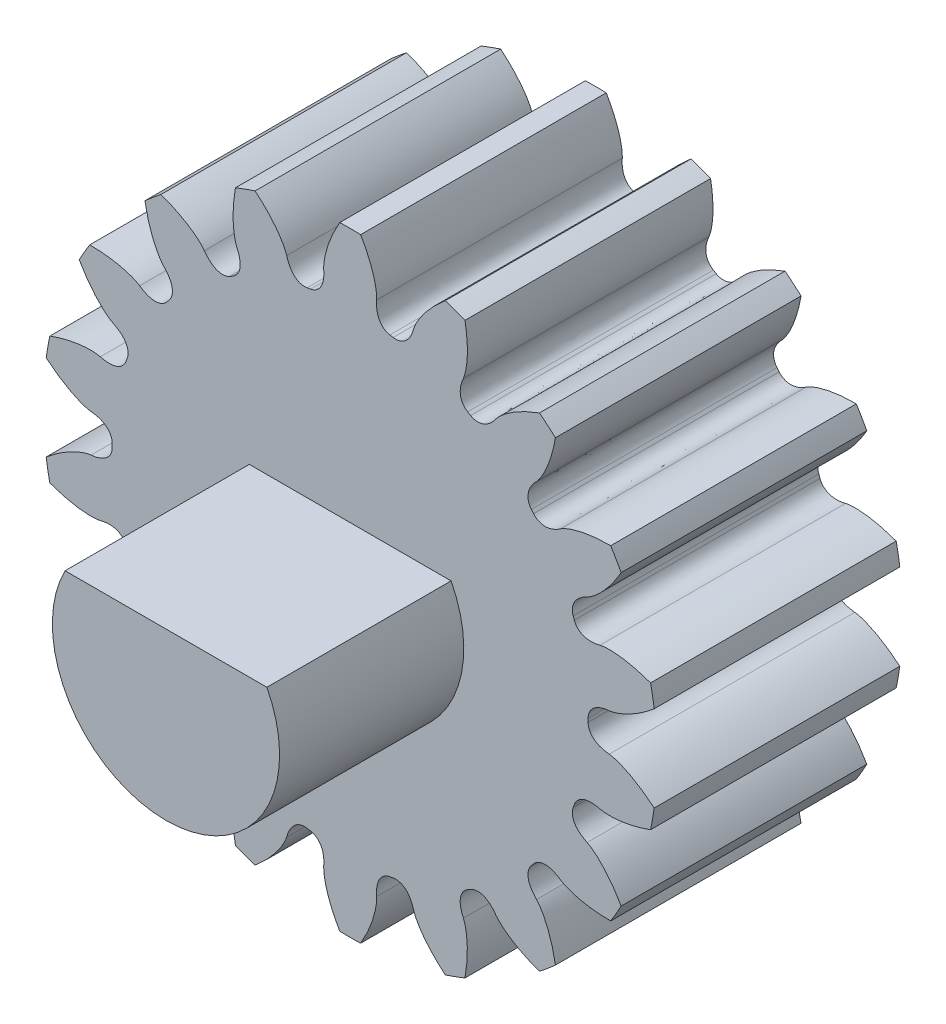
from build123d import *

# Parameters (mm, degrees)
SKETCH1_R           = 5.5
EXTRUDE1_DEPTH      = 4
EXTRUDE2_DEPTH      = 3
EXTRUDE3_DEPTH      = 3.5
EXTRUDE5_DEPTH      = 11.464224768
EXTRUDE5_DEPTH_BACK = 11.464224768
SKETCH4_R           = 6.338783536


with BuildPart() as part:
    # Sketch1 → Extrude1 (new body)
    with BuildSketch(Plane.XY):
        Circle(SKETCH1_R)
    extrude(amount=EXTRUDE1_DEPTH)

    # Sketch2 → Extrude2 (add)
    with BuildSketch(Plane.XY.offset(4)):
        with BuildLine():
            ThreePointArc((-1.643167673, 0.85), (0, -1.85), (1.643167673, 0.85))
            Line((1.643167673, 0.85), (-1.643167673, 0.85))
        make_face()
    extrude(amount=EXTRUDE2_DEPTH)

    # Sketch3 → Extrude3 (cut)
    with BuildSketch(Plane(origin=(0, 0, 0), x_dir=(-1, 0, 0), z_dir=(0, 0, -1))):
        with BuildLine():
            ThreePointArc((-1.183215957, 1.15), (0, -1.65), (1.183215957, 1.15))
            Line((1.183215957, 1.15), (-1.183215957, 1.15))
        make_face()
    extrude(amount=-EXTRUDE3_DEPTH, mode=Mode.SUBTRACT)

    # Sketch4 → Extrude5 (cut, two sides: drawn at the far end of the back side and taken through both)
    with BuildSketch(Plane.XY.offset(-EXTRUDE5_DEPTH_BACK)):
        Circle(SKETCH4_R)
        with BuildLine():
            ThreePointArc((-0.645581629, 3.820844064), (-0.672886688, 3.816130043), (-0.700157341, 3.811220893))
            add(Edge.make_bspline(
                [(-1.033630549, 4.101069767), (-1.023055352, 4.057563785), (-1.007391639, 4.016629667), (-0.986639413, 3.978267412), (-0.974742217, 3.956274435), (-0.961550555, 3.934381948), (-0.945930501, 3.914824361), (-0.934621825, 3.900664971), (-0.922273971, 3.88695488), (-0.908780274, 3.874846556), (-0.897658569, 3.864866696), (-0.885714305, 3.85548826), (-0.873152403, 3.847388455), (-0.861998879, 3.840196761), (-0.850198651, 3.833694375), (-0.838069558, 3.828303491), (-0.826810099, 3.823299124), (-0.815055067, 3.819044124), (-0.803167091, 3.815800059), (-0.791816041, 3.812702513), (-0.780107092, 3.810398525), (-0.768419709, 3.809033981), (-0.757043467, 3.807705765), (-0.745440399, 3.807203948), (-0.733992753, 3.807581383), (-0.722686966, 3.807954141), (-0.711408495, 3.809167311), (-0.700157341, 3.811220893)],
                knots=[0, 0, 0, 0, 1, 1, 1, 2, 2, 2, 3, 3, 3, 4, 4, 4, 5, 5, 5, 6, 6, 6, 7, 7, 7, 8, 8, 8, 9, 9, 9, 9], degree=3))
            add(Edge.make_bspline(
                [(-1.033630549, 4.101069767), (-1.042964335, 4.128461375), (-1.053737549, 4.155176869), (-1.065950192, 4.181216248), (-1.078417533, 4.207798686), (-1.092953075, 4.233520587), (-1.107852498, 4.258849733), (-1.123046455, 4.284679588), (-1.139430845, 4.309879699), (-1.156341967, 4.334627531), (-1.17357983, 4.359853517), (-1.191731228, 4.384510939), (-1.210387, 4.408711326), (-1.229396009, 4.433369934), (-1.249168041, 4.457488062), (-1.269409797, 4.481147841), (-1.290027516, 4.505247067), (-1.311310066, 4.528820391), (-1.333029253, 4.551933707), (-1.355144386, 4.575468383), (-1.377853424, 4.598484746), (-1.400969349, 4.621038616), (-1.424499074, 4.643996224), (-1.448567936, 4.666438989), (-1.473017052, 4.688416004), (-1.497896092, 4.710779472), (-1.523223717, 4.732643722), (-1.548999928, 4.754008753)],
                knots=[0, 0, 0, 0, 1, 1, 1, 2, 2, 2, 3, 3, 3, 4, 4, 4, 5, 5, 5, 6, 6, 6, 7, 7, 7, 8, 8, 8, 9, 9, 9, 9], degree=3))
            ThreePointArc((-1.548999928, 4.754008753), (-1.710100717, 4.698463104), (-1.869215136, 4.637459949))
            add(Edge.make_bspline(
                [(-1.844309894, 3.806006616), (-1.854766786, 3.832989447), (-1.863686414, 3.860379591), (-1.871068777, 3.888177048), (-1.878605101, 3.91655423), (-1.884003949, 3.945601615), (-1.888871589, 3.974582031), (-1.893835454, 4.004135335), (-1.897482602, 4.033971423), (-1.900435531, 4.063799622), (-1.903445513, 4.094204133), (-1.905390221, 4.124760307), (-1.90665478, 4.155290579), (-1.907943282, 4.186398925), (-1.908299861, 4.2175837), (-1.908001988, 4.248719291), (-1.907698584, 4.280433184), (-1.906547845, 4.312171557), (-1.904766935, 4.343838209), (-1.902953558, 4.37608215), (-1.90035206, 4.408310795), (-1.897141581, 4.440446693), (-1.893873632, 4.473157856), (-1.889861745, 4.505821177), (-1.885259189, 4.538372137), (-1.880575699, 4.571495486), (-1.875227681, 4.604524757), (-1.869215136, 4.637459949)],
                knots=[0, 0, 0, 0, 1, 1, 1, 2, 2, 2, 3, 3, 3, 4, 4, 4, 5, 5, 5, 6, 6, 6, 7, 7, 7, 8, 8, 8, 9, 9, 9, 9], degree=3))
            add(Edge.make_bspline(
                [(-1.844309894, 3.806006616), (-1.824445859, 3.765881494), (-1.810133015, 3.7244557), (-1.801371361, 3.681729234), (-1.796348328, 3.657234266), (-1.792381509, 3.631984211), (-1.791775789, 3.606961854), (-1.791337258, 3.588846055), (-1.791983586, 3.570406468), (-1.794537277, 3.552457372), (-1.796642067, 3.537663462), (-1.799763561, 3.522801538), (-1.804180083, 3.508522093), (-1.808101446, 3.495843588), (-1.812961291, 3.483277431), (-1.818787523, 3.471351344), (-1.824196023, 3.460280336), (-1.830465839, 3.449464828), (-1.837487312, 3.439338286), (-1.844191657, 3.429669113), (-1.851680257, 3.420377789), (-1.8597562, 3.411819983), (-1.867617146, 3.403490003), (-1.87618305, 3.39564728), (-1.885195066, 3.388578007), (-1.894095406, 3.381596337), (-1.903515026, 3.375276018), (-1.913453928, 3.369617051)],
                knots=[0, 0, 0, 0, 1, 1, 1, 2, 2, 2, 3, 3, 3, 4, 4, 4, 5, 5, 5, 6, 6, 6, 7, 7, 7, 8, 8, 8, 9, 9, 9, 9], degree=3))
            ThreePointArc((-1.913453928, 3.369617051), (-1.9375, 3.35584844), (-1.961447003, 3.341908235))
            add(Edge.make_bspline(
                [(-2.373943469, 3.500222529), (-2.349126112, 3.462957209), (-2.320406744, 3.429849025), (-2.287785366, 3.400897977), (-2.269083617, 3.384300419), (-2.249199838, 3.368240026), (-2.227832701, 3.355204278), (-2.212363225, 3.345766599), (-2.19607091, 3.337106542), (-2.179249692, 3.330343556), (-2.165385394, 3.324769402), (-2.150953843, 3.320041734), (-2.136379221, 3.316726831), (-2.123438632, 3.313783578), (-2.110126099, 3.31170925), (-2.096884688, 3.31079187), (-2.084592663, 3.309940266), (-2.072091251, 3.309962331), (-2.059810672, 3.310979834), (-2.048084751, 3.311951381), (-2.036293927, 3.313791036), (-2.024844678, 3.316506106), (-2.013700231, 3.319148895), (-2.002625282, 3.322645824), (-1.991997104, 3.326915822), (-1.98150063, 3.331132907), (-1.971317263, 3.336130378), (-1.961447003, 3.341908235)],
                knots=[0, 0, 0, 0, 1, 1, 1, 2, 2, 2, 3, 3, 3, 4, 4, 4, 5, 5, 5, 6, 6, 6, 7, 7, 7, 8, 8, 8, 9, 9, 9, 9], degree=3))
            add(Edge.make_bspline(
                [(-2.373943469, 3.500222529), (-2.39208284, 3.522769878), (-2.411343587, 3.544189574), (-2.43172571, 3.564481617), (-2.452532908, 3.585196856), (-2.474989257, 3.604396088), (-2.497653214, 3.623101797), (-2.520765194, 3.642177282), (-2.544780429, 3.660253848), (-2.569135943, 3.677725259), (-2.593962031, 3.695534236), (-2.6194521, 3.712496489), (-2.645259812, 3.728856765), (-2.671556178, 3.745526813), (-2.698384696, 3.761428007), (-2.725497846, 3.776737838), (-2.753114585, 3.792332028), (-2.781176191, 3.807204646), (-2.809490771, 3.821495658), (-2.838321532, 3.836047199), (-2.867533107, 3.849908557), (-2.89696885, 3.863196151), (-2.926931522, 3.876721605), (-2.957224732, 3.88957887), (-2.987715968, 3.901868418), (-3.018743375, 3.914374072), (-3.050021571, 3.926257188), (-3.081550557, 3.937517767)],
                knots=[0, 0, 0, 0, 1, 1, 1, 2, 2, 2, 3, 3, 3, 4, 4, 4, 5, 5, 5, 6, 6, 6, 7, 7, 7, 8, 8, 8, 9, 9, 9, 9], degree=3))
            ThreePointArc((-3.081550557, 3.937517767), (-3.213938048, 3.830222216), (-3.342592386, 3.718477664))
            add(Edge.make_bspline(
                [(-3.034815326, 2.945685197), (-3.053870262, 2.967464297), (-3.071619951, 2.990151921), (-3.088064394, 3.013748069), (-3.10485179, 3.037836323), (-3.119859838, 3.063285421), (-3.13434581, 3.088853274), (-3.149118143, 3.114926554), (-3.162749884, 3.141715907), (-3.175726574, 3.168735285), (-3.188953987, 3.196276704), (-3.201232242, 3.224324987), (-3.212862506, 3.252581553), (-3.224712983, 3.281373143), (-3.235713879, 3.310555288), (-3.24608297, 3.339915052), (-3.256644653, 3.369820134), (-3.266418475, 3.400038025), (-3.2755756, 3.430404051), (-3.284899661, 3.461323655), (-3.293477897, 3.492498441), (-3.301452159, 3.523794355), (-3.309569168, 3.555650497), (-3.316970741, 3.587716126), (-3.323778837, 3.619878189), (-3.330706648, 3.652605804), (-3.336977831, 3.685472296), (-3.342592386, 3.718477664)],
                knots=[0, 0, 0, 0, 1, 1, 1, 2, 2, 2, 3, 3, 3, 4, 4, 4, 5, 5, 5, 6, 6, 6, 7, 7, 7, 8, 8, 8, 9, 9, 9, 9], degree=3))
            add(Edge.make_bspline(
                [(-3.034815326, 2.945685197), (-3.002425639, 2.914773816), (-2.974807509, 2.880741585), (-2.951960936, 2.843588502), (-2.938863056, 2.822288739), (-2.926499438, 2.799918181), (-2.917372097, 2.776612025), (-2.910764044, 2.759738729), (-2.905064684, 2.742190128), (-2.901325417, 2.724450082), (-2.898243457, 2.709828473), (-2.896093624, 2.694795218), (-2.895359939, 2.67986639), (-2.894708511, 2.666611307), (-2.894977393, 2.653140818), (-2.896373298, 2.639941273), (-2.897669118, 2.627688112), (-2.899861696, 2.615380456), (-2.902996241, 2.603463134), (-2.905989213, 2.592084063), (-2.909848375, 2.580791821), (-2.914510337, 2.569987979), (-2.919048189, 2.559471757), (-2.924415137, 2.549172296), (-2.930465828, 2.539447062), (-2.93644154, 2.529842342), (-2.943131411, 2.520681485), (-2.950535442, 2.511964491)],
                knots=[0, 0, 0, 0, 1, 1, 1, 2, 2, 2, 3, 3, 3, 4, 4, 4, 5, 5, 5, 6, 6, 6, 7, 7, 7, 8, 8, 8, 9, 9, 9, 9], degree=3))
            ThreePointArc((-2.950535442, 2.511964491), (-2.968422217, 2.490801988), (-2.986157208, 2.469512123))
            add(Edge.make_bspline(
                [(-3.427923771, 2.477196796), (-3.391857593, 2.450666886), (-3.35354655, 2.429377972), (-3.31299064, 2.413330055), (-3.289740046, 2.404129826), (-3.265562427, 2.395838646), (-3.241025398, 2.390897042), (-3.223260969, 2.387319397), (-3.204989287, 2.384753905), (-3.186869435, 2.384151972), (-3.171934784, 2.38365585), (-3.156756604, 2.384149176), (-3.141927175, 2.386019001), (-3.128760348, 2.38767919), (-3.115541196, 2.390283114), (-3.102784578, 2.393949888), (-3.090942587, 2.397353761), (-3.079202649, 2.401650231), (-3.068010686, 2.406806576), (-3.057324213, 2.411730033), (-3.046873662, 2.417491443), (-3.037043496, 2.423958647), (-3.027475028, 2.430253682), (-3.018264, 2.437327576), (-3.009737206, 2.444975113), (-3.001316074, 2.452527882), (-2.993456075, 2.460706885), (-2.986157208, 2.469512123)],
                knots=[0, 0, 0, 0, 1, 1, 1, 2, 2, 2, 3, 3, 3, 4, 4, 4, 5, 5, 5, 6, 6, 6, 7, 7, 7, 8, 8, 8, 9, 9, 9, 9], degree=3))
            add(Edge.make_bspline(
                [(-3.427923771, 2.477196796), (-3.452680852, 2.492180344), (-3.478106001, 2.505720711), (-3.504199219, 2.517817897), (-3.530836618, 2.530167373), (-3.558505208, 2.540528226), (-3.58620009, 2.550354312), (-3.614442447, 2.560374642), (-3.643191937, 2.569147364), (-3.672054208, 2.577235044), (-3.701474128, 2.585478986), (-3.73122839, 2.592700173), (-3.76107525, 2.599247046), (-3.791487244, 2.60591788), (-3.822136333, 2.611684221), (-3.85285063, 2.616797513), (-3.884135403, 2.622005777), (-3.915591423, 2.626383832), (-3.947086239, 2.630128834), (-3.979155211, 2.633942109), (-4.011345977, 2.636976578), (-4.043551152, 2.639395214), (-4.076332832, 2.641857146), (-4.109196581, 2.643578135), (-4.142052244, 2.644697917), (-4.175485654, 2.645837388), (-4.20894181, 2.646306092), (-4.24242071, 2.646104027)],
                knots=[0, 0, 0, 0, 1, 1, 1, 2, 2, 2, 3, 3, 3, 4, 4, 4, 5, 5, 5, 6, 6, 6, 7, 7, 7, 8, 8, 8, 9, 9, 9, 9], degree=3))
            ThreePointArc((-4.24242071, 2.646104027), (-4.330127019, 2.5), (-4.412803663, 2.350992095))
            add(Edge.make_bspline(
                [(-3.859277241, 1.73007067), (-3.884631914, 1.744019157), (-3.909070791, 1.759267799), (-3.93259387, 1.775816595), (-3.95660753, 1.792710521), (-3.979414586, 1.811491797), (-4.001771668, 1.830563225), (-4.024570707, 1.850011658), (-4.046542852, 1.870523086), (-4.067978123, 1.891474706), (-4.089827546, 1.912831133), (-4.11095841, 1.934988487), (-4.131551598, 1.957563189), (-4.152534707, 1.980565332), (-4.172853049, 2.00422505), (-4.192638438, 2.028267766), (-4.212791314, 2.052757042), (-4.23231083, 2.077809727), (-4.251301505, 2.103212537), (-4.270638384, 2.129078444), (-4.289361694, 2.15543923), (-4.307558882, 2.182120412), (-4.326081818, 2.209279213), (-4.344004113, 2.236879561), (-4.361401703, 2.264773509), (-4.37910522, 2.293157956), (-4.396239207, 2.321897484), (-4.412803663, 2.350992095)],
                knots=[0, 0, 0, 0, 1, 1, 1, 2, 2, 2, 3, 3, 3, 4, 4, 4, 5, 5, 5, 6, 6, 6, 7, 7, 7, 8, 8, 8, 9, 9, 9, 9], degree=3))
            add(Edge.make_bspline(
                [(-3.859277241, 1.73007067), (-3.818268576, 1.712101399), (-3.780676314, 1.689567519), (-3.746500455, 1.662469029), (-3.726907527, 1.646933538), (-3.707638344, 1.630140697), (-3.691090275, 1.611361808), (-3.679109729, 1.597766184), (-3.667752107, 1.583225188), (-3.658170892, 1.567833903), (-3.650273912, 1.555148177), (-3.643112055, 1.541756825), (-3.637316656, 1.52797925), (-3.632171009, 1.515746348), (-3.627816497, 1.502996265), (-3.624613707, 1.490115323), (-3.621640553, 1.478157921), (-3.619491436, 1.465842602), (-3.61836098, 1.453571905), (-3.617281582, 1.441855419), (-3.617045834, 1.429924272), (-3.617731514, 1.418177497), (-3.61839894, 1.406743443), (-3.619919599, 1.395229511), (-3.622279162, 1.384021322), (-3.624609487, 1.372952024), (-3.627762712, 1.362055564), (-3.631738838, 1.351331941)],
                knots=[0, 0, 0, 0, 1, 1, 1, 2, 2, 2, 3, 3, 3, 4, 4, 4, 5, 5, 5, 6, 6, 6, 7, 7, 7, 8, 8, 8, 9, 9, 9, 9], degree=3))
            ThreePointArc((-3.631738838, 1.351331941), (-3.641308906, 1.325328055), (-3.650692784, 1.299256403))
            add(Edge.make_bspline(
                [(-4.068445875, 1.15538457), (-4.025480991, 1.142789968), (-3.982199149, 1.135888082), (-3.938600348, 1.13467891), (-3.913605273, 1.133985695), (-3.888049993, 1.134463767), (-3.863302599, 1.138212336), (-3.845385869, 1.140926242), (-3.827338655, 1.144764752), (-3.81010569, 1.150396474), (-3.795902025, 1.155038224), (-3.781807929, 1.160693041), (-3.768512342, 1.167522065), (-3.75670739, 1.173585453), (-3.745176045, 1.180553557), (-3.734442856, 1.188362218), (-3.724479217, 1.195611012), (-3.714916763, 1.203663668), (-3.706163332, 1.212336925), (-3.697805254, 1.22061845), (-3.689955467, 1.229606703), (-3.682930046, 1.239046002), (-3.676091656, 1.248234008), (-3.669855536, 1.258031652), (-3.664458581, 1.268134322), (-3.659128505, 1.278111799), (-3.654539906, 1.288485826), (-3.650692784, 1.299256403)],
                knots=[0, 0, 0, 0, 1, 1, 1, 2, 2, 2, 3, 3, 3, 4, 4, 4, 5, 5, 5, 6, 6, 6, 7, 7, 7, 8, 8, 8, 9, 9, 9, 9], degree=3))
            add(Edge.make_bspline(
                [(-4.068445875, 1.15538457), (-4.096834597, 1.160997079), (-4.1253575, 1.165024948), (-4.154014586, 1.167468179), (-4.183269323, 1.169962364), (-4.212812913, 1.170235165), (-4.242198309, 1.169996459), (-4.272164598, 1.169753034), (-4.302180729, 1.168163792), (-4.332068541, 1.165892246), (-4.362533817, 1.163576812), (-4.39296347, 1.160185952), (-4.423249506, 1.156129773), (-4.454108992, 1.151996792), (-4.48488192, 1.146932774), (-4.515492767, 1.141232789), (-4.546672168, 1.135426933), (-4.577728541, 1.128782367), (-4.608604853, 1.121529656), (-4.640044047, 1.114144727), (-4.671331321, 1.105986306), (-4.702421508, 1.097244262), (-4.734068242, 1.088345726), (-4.765538677, 1.078722863), (-4.796795889, 1.068537814), (-4.82860274, 1.058173668), (-4.860201549, 1.047171426), (-4.891592314, 1.035531089)],
                knots=[0, 0, 0, 0, 1, 1, 1, 2, 2, 2, 3, 3, 3, 4, 4, 4, 5, 5, 5, 6, 6, 6, 7, 7, 7, 8, 8, 8, 9, 9, 9, 9], degree=3))
            ThreePointArc((-4.891592314, 1.035531089), (-4.924038765, 0.868240888), (-4.950765693, 0.699942181))
            add(Edge.make_bspline(
                [(-4.218253363, 0.305784087), (-4.246849626, 0.310219568), (-4.275030001, 0.316190016), (-4.302794487, 0.323695431), (-4.331138009, 0.331357374), (-4.358993206, 0.341205527), (-4.386524803, 0.351480235), (-4.414600648, 0.361958054), (-4.442263032, 0.373717574), (-4.469571474, 0.386074363), (-4.497407544, 0.398669897), (-4.524842321, 0.412263818), (-4.551914591, 0.426433814), (-4.57949946, 0.440872112), (-4.606684557, 0.456155692), (-4.633499834, 0.471981453), (-4.660813168, 0.488101156), (-4.687724036, 0.504966911), (-4.714257706, 0.522342551), (-4.74127509, 0.540034951), (-4.767885166, 0.558402238), (-4.794110431, 0.577250542), (-4.820805154, 0.596436251), (-4.847086477, 0.616242308), (-4.872975156, 0.636503718), (-4.899319073, 0.657121414), (-4.925249252, 0.678267569), (-4.950765693, 0.699942181)],
                knots=[0, 0, 0, 0, 1, 1, 1, 2, 2, 2, 3, 3, 3, 4, 4, 4, 5, 5, 5, 6, 6, 6, 7, 7, 7, 8, 8, 8, 9, 9, 9, 9], degree=3))
            add(Edge.make_bspline(
                [(-4.218253363, 0.305784087), (-4.173571971, 0.302924285), (-4.130539759, 0.294606675), (-4.089156727, 0.280831257), (-4.065431946, 0.272933846), (-4.041581347, 0.263744186), (-4.01960849, 0.251757575), (-4.003700482, 0.243079456), (-3.988054496, 0.233299925), (-3.973786969, 0.222113816), (-3.962027461, 0.212894059), (-3.950717405, 0.202759804), (-3.940559303, 0.191795262), (-3.931540078, 0.18206001), (-3.92308739, 0.171568182), (-3.91567221, 0.160559473), (-3.908788686, 0.15034007), (-3.90255709, 0.139502497), (-3.897297983, 0.128358452), (-3.892276407, 0.117717733), (-3.887974184, 0.106586752), (-3.884600879, 0.095313877), (-3.881317377, 0.084341108), (-3.878808332, 0.073001456), (-3.87719217, 0.061662185), (-3.875596036, 0.05046343), (-3.874832289, 0.03914564), (-3.874900931, 0.027708815)],
                knots=[0, 0, 0, 0, 1, 1, 1, 2, 2, 2, 3, 3, 3, 4, 4, 4, 5, 5, 5, 6, 6, 6, 7, 7, 7, 8, 8, 8, 9, 9, 9, 9], degree=3))
            ThreePointArc((-3.874900931, 0.027708815), (-3.875, 0), (-3.874900931, -0.027708815))
            add(Edge.make_bspline(
                [(-4.218253363, -0.305784087), (-4.173571971, -0.302924285), (-4.130539759, -0.294606675), (-4.089156727, -0.280831257), (-4.065431946, -0.272933846), (-4.041581347, -0.263744186), (-4.01960849, -0.251757575), (-4.003700482, -0.243079456), (-3.988054496, -0.233299925), (-3.973786969, -0.222113816), (-3.962027461, -0.212894059), (-3.950717405, -0.202759804), (-3.940559303, -0.191795262), (-3.931540078, -0.18206001), (-3.92308739, -0.171568182), (-3.91567221, -0.160559473), (-3.908788686, -0.15034007), (-3.90255709, -0.139502497), (-3.897297983, -0.128358452), (-3.892276407, -0.117717733), (-3.887974184, -0.106586752), (-3.884600879, -0.095313877), (-3.881317377, -0.084341108), (-3.878808332, -0.073001456), (-3.87719217, -0.061662185), (-3.875596036, -0.05046343), (-3.874832289, -0.03914564), (-3.874900931, -0.027708815)],
                knots=[0, 0, 0, 0, 1, 1, 1, 2, 2, 2, 3, 3, 3, 4, 4, 4, 5, 5, 5, 6, 6, 6, 7, 7, 7, 8, 8, 8, 9, 9, 9, 9], degree=3))
            add(Edge.make_bspline(
                [(-4.218253363, -0.305784087), (-4.246849626, -0.310219568), (-4.275030001, -0.316190016), (-4.302794487, -0.323695431), (-4.331138009, -0.331357374), (-4.358993206, -0.341205527), (-4.386524803, -0.351480235), (-4.414600648, -0.361958054), (-4.442263032, -0.373717574), (-4.469571474, -0.386074363), (-4.497407544, -0.398669897), (-4.524842321, -0.412263818), (-4.551914591, -0.426433814), (-4.57949946, -0.440872112), (-4.606684557, -0.456155692), (-4.633499834, -0.471981453), (-4.660813168, -0.488101156), (-4.687724036, -0.504966911), (-4.714257706, -0.522342551), (-4.74127509, -0.540034951), (-4.767885166, -0.558402238), (-4.794110431, -0.577250542), (-4.820805154, -0.596436251), (-4.847086477, -0.616242308), (-4.872975156, -0.636503718), (-4.899319073, -0.657121414), (-4.925249252, -0.678267569), (-4.950765693, -0.699942181)],
                knots=[0, 0, 0, 0, 1, 1, 1, 2, 2, 2, 3, 3, 3, 4, 4, 4, 5, 5, 5, 6, 6, 6, 7, 7, 7, 8, 8, 8, 9, 9, 9, 9], degree=3))
            ThreePointArc((-4.950765693, -0.699942181), (-4.924038765, -0.868240888), (-4.891592314, -1.035531089))
            add(Edge.make_bspline(
                [(-4.068445875, -1.15538457), (-4.096834597, -1.160997079), (-4.1253575, -1.165024948), (-4.154014586, -1.167468179), (-4.183269323, -1.169962364), (-4.212812913, -1.170235165), (-4.242198309, -1.169996459), (-4.272164598, -1.169753034), (-4.302180729, -1.168163792), (-4.332068541, -1.165892246), (-4.362533817, -1.163576812), (-4.39296347, -1.160185952), (-4.423249506, -1.156129773), (-4.454108992, -1.151996792), (-4.48488192, -1.146932774), (-4.515492767, -1.141232789), (-4.546672168, -1.135426933), (-4.577728541, -1.128782367), (-4.608604853, -1.121529656), (-4.640044047, -1.114144727), (-4.671331321, -1.105986306), (-4.702421508, -1.097244262), (-4.734068242, -1.088345726), (-4.765538677, -1.078722863), (-4.796795889, -1.068537814), (-4.82860274, -1.058173668), (-4.860201549, -1.047171426), (-4.891592314, -1.035531089)],
                knots=[0, 0, 0, 0, 1, 1, 1, 2, 2, 2, 3, 3, 3, 4, 4, 4, 5, 5, 5, 6, 6, 6, 7, 7, 7, 8, 8, 8, 9, 9, 9, 9], degree=3))
            add(Edge.make_bspline(
                [(-4.068445875, -1.15538457), (-4.025480991, -1.142789968), (-3.982199149, -1.135888082), (-3.938600348, -1.13467891), (-3.913605273, -1.133985695), (-3.888049993, -1.134463767), (-3.863302599, -1.138212336), (-3.845385869, -1.140926242), (-3.827338655, -1.144764752), (-3.81010569, -1.150396474), (-3.795902025, -1.155038224), (-3.781807929, -1.160693041), (-3.768512342, -1.167522065), (-3.75670739, -1.173585453), (-3.745176045, -1.180553557), (-3.734442856, -1.188362218), (-3.724479217, -1.195611012), (-3.714916763, -1.203663668), (-3.706163332, -1.212336925), (-3.697805254, -1.22061845), (-3.689955467, -1.229606703), (-3.682930046, -1.239046002), (-3.676091656, -1.248234008), (-3.669855536, -1.258031652), (-3.664458581, -1.268134322), (-3.659128505, -1.278111799), (-3.654539906, -1.288485826), (-3.650692784, -1.299256403)],
                knots=[0, 0, 0, 0, 1, 1, 1, 2, 2, 2, 3, 3, 3, 4, 4, 4, 5, 5, 5, 6, 6, 6, 7, 7, 7, 8, 8, 8, 9, 9, 9, 9], degree=3))
            ThreePointArc((-3.650692784, -1.299256403), (-3.641308906, -1.325328055), (-3.631738838, -1.351331941))
            add(Edge.make_bspline(
                [(-3.859277241, -1.73007067), (-3.818268576, -1.712101399), (-3.780676314, -1.689567519), (-3.746500455, -1.662469029), (-3.726907527, -1.646933538), (-3.707638344, -1.630140697), (-3.691090275, -1.611361808), (-3.679109729, -1.597766184), (-3.667752107, -1.583225188), (-3.658170892, -1.567833903), (-3.650273912, -1.555148177), (-3.643112055, -1.541756825), (-3.637316656, -1.52797925), (-3.632171009, -1.515746348), (-3.627816497, -1.502996265), (-3.624613707, -1.490115323), (-3.621640553, -1.478157921), (-3.619491436, -1.465842602), (-3.61836098, -1.453571905), (-3.617281582, -1.441855419), (-3.617045834, -1.429924272), (-3.617731514, -1.418177497), (-3.61839894, -1.406743443), (-3.619919599, -1.395229511), (-3.622279162, -1.384021322), (-3.624609487, -1.372952024), (-3.627762712, -1.362055564), (-3.631738838, -1.351331941)],
                knots=[0, 0, 0, 0, 1, 1, 1, 2, 2, 2, 3, 3, 3, 4, 4, 4, 5, 5, 5, 6, 6, 6, 7, 7, 7, 8, 8, 8, 9, 9, 9, 9], degree=3))
            add(Edge.make_bspline(
                [(-3.859277241, -1.73007067), (-3.884631914, -1.744019157), (-3.909070791, -1.759267799), (-3.93259387, -1.775816595), (-3.95660753, -1.792710521), (-3.979414586, -1.811491797), (-4.001771668, -1.830563225), (-4.024570707, -1.850011658), (-4.046542852, -1.870523086), (-4.067978123, -1.891474706), (-4.089827546, -1.912831133), (-4.11095841, -1.934988487), (-4.131551598, -1.957563189), (-4.152534707, -1.980565332), (-4.172853049, -2.00422505), (-4.192638438, -2.028267766), (-4.212791314, -2.052757042), (-4.23231083, -2.077809727), (-4.251301505, -2.103212537), (-4.270638384, -2.129078444), (-4.289361694, -2.15543923), (-4.307558882, -2.182120412), (-4.326081818, -2.209279213), (-4.344004113, -2.236879561), (-4.361401703, -2.264773509), (-4.37910522, -2.293157956), (-4.396239207, -2.321897484), (-4.412803663, -2.350992095)],
                knots=[0, 0, 0, 0, 1, 1, 1, 2, 2, 2, 3, 3, 3, 4, 4, 4, 5, 5, 5, 6, 6, 6, 7, 7, 7, 8, 8, 8, 9, 9, 9, 9], degree=3))
            ThreePointArc((-4.412803663, -2.350992095), (-4.330127019, -2.5), (-4.24242071, -2.646104027))
            add(Edge.make_bspline(
                [(-3.427923771, -2.477196796), (-3.452680852, -2.492180344), (-3.478106001, -2.505720711), (-3.504199219, -2.517817897), (-3.530836618, -2.530167373), (-3.558505208, -2.540528226), (-3.58620009, -2.550354312), (-3.614442447, -2.560374642), (-3.643191937, -2.569147364), (-3.672054208, -2.577235044), (-3.701474128, -2.585478986), (-3.73122839, -2.592700173), (-3.76107525, -2.599247046), (-3.791487244, -2.60591788), (-3.822136333, -2.611684221), (-3.85285063, -2.616797513), (-3.884135403, -2.622005777), (-3.915591423, -2.626383832), (-3.947086239, -2.630128834), (-3.979155211, -2.633942109), (-4.011345977, -2.636976578), (-4.043551152, -2.639395214), (-4.076332832, -2.641857146), (-4.109196581, -2.643578135), (-4.142052244, -2.644697917), (-4.175485654, -2.645837388), (-4.20894181, -2.646306092), (-4.24242071, -2.646104027)],
                knots=[0, 0, 0, 0, 1, 1, 1, 2, 2, 2, 3, 3, 3, 4, 4, 4, 5, 5, 5, 6, 6, 6, 7, 7, 7, 8, 8, 8, 9, 9, 9, 9], degree=3))
            add(Edge.make_bspline(
                [(-3.427923771, -2.477196796), (-3.391857593, -2.450666886), (-3.35354655, -2.429377972), (-3.31299064, -2.413330055), (-3.289740046, -2.404129826), (-3.265562427, -2.395838646), (-3.241025398, -2.390897042), (-3.223260969, -2.387319397), (-3.204989287, -2.384753905), (-3.186869435, -2.384151972), (-3.171934784, -2.38365585), (-3.156756604, -2.384149176), (-3.141927175, -2.386019001), (-3.128760348, -2.38767919), (-3.115541196, -2.390283114), (-3.102784578, -2.393949888), (-3.090942587, -2.397353761), (-3.079202649, -2.401650231), (-3.068010686, -2.406806576), (-3.057324213, -2.411730033), (-3.046873662, -2.417491443), (-3.037043496, -2.423958647), (-3.027475028, -2.430253682), (-3.018264, -2.437327576), (-3.009737206, -2.444975113), (-3.001316074, -2.452527882), (-2.993456075, -2.460706885), (-2.986157208, -2.469512123)],
                knots=[0, 0, 0, 0, 1, 1, 1, 2, 2, 2, 3, 3, 3, 4, 4, 4, 5, 5, 5, 6, 6, 6, 7, 7, 7, 8, 8, 8, 9, 9, 9, 9], degree=3))
            ThreePointArc((-2.986157208, -2.469512123), (-2.968422217, -2.490801988), (-2.950535442, -2.511964491))
            add(Edge.make_bspline(
                [(-3.034815326, -2.945685197), (-3.002425639, -2.914773816), (-2.974807509, -2.880741585), (-2.951960936, -2.843588502), (-2.938863056, -2.822288739), (-2.926499438, -2.799918181), (-2.917372097, -2.776612025), (-2.910764044, -2.759738729), (-2.905064684, -2.742190128), (-2.901325417, -2.724450082), (-2.898243457, -2.709828473), (-2.896093624, -2.694795218), (-2.895359939, -2.67986639), (-2.894708511, -2.666611307), (-2.894977393, -2.653140818), (-2.896373298, -2.639941273), (-2.897669118, -2.627688112), (-2.899861696, -2.615380456), (-2.902996241, -2.603463134), (-2.905989213, -2.592084063), (-2.909848375, -2.580791821), (-2.914510337, -2.569987979), (-2.919048189, -2.559471757), (-2.924415137, -2.549172296), (-2.930465828, -2.539447062), (-2.93644154, -2.529842342), (-2.943131411, -2.520681485), (-2.950535442, -2.511964491)],
                knots=[0, 0, 0, 0, 1, 1, 1, 2, 2, 2, 3, 3, 3, 4, 4, 4, 5, 5, 5, 6, 6, 6, 7, 7, 7, 8, 8, 8, 9, 9, 9, 9], degree=3))
            add(Edge.make_bspline(
                [(-3.034815326, -2.945685197), (-3.053870262, -2.967464297), (-3.071619951, -2.990151921), (-3.088064394, -3.013748069), (-3.10485179, -3.037836323), (-3.119859838, -3.063285421), (-3.13434581, -3.088853274), (-3.149118143, -3.114926554), (-3.162749884, -3.141715907), (-3.175726574, -3.168735285), (-3.188953987, -3.196276704), (-3.201232242, -3.224324987), (-3.212862506, -3.252581553), (-3.224712983, -3.281373143), (-3.235713879, -3.310555288), (-3.24608297, -3.339915052), (-3.256644653, -3.369820134), (-3.266418475, -3.400038025), (-3.2755756, -3.430404051), (-3.284899661, -3.461323655), (-3.293477897, -3.492498441), (-3.301452159, -3.523794355), (-3.309569168, -3.555650497), (-3.316970741, -3.587716126), (-3.323778837, -3.619878189), (-3.330706648, -3.652605804), (-3.336977831, -3.685472296), (-3.342592386, -3.718477664)],
                knots=[0, 0, 0, 0, 1, 1, 1, 2, 2, 2, 3, 3, 3, 4, 4, 4, 5, 5, 5, 6, 6, 6, 7, 7, 7, 8, 8, 8, 9, 9, 9, 9], degree=3))
            ThreePointArc((-3.342592386, -3.718477664), (-3.213938048, -3.830222216), (-3.081550557, -3.937517767))
            add(Edge.make_bspline(
                [(-2.373943469, -3.500222529), (-2.39208284, -3.522769878), (-2.411343587, -3.544189574), (-2.43172571, -3.564481617), (-2.452532908, -3.585196856), (-2.474989257, -3.604396088), (-2.497653214, -3.623101797), (-2.520765194, -3.642177282), (-2.544780429, -3.660253848), (-2.569135943, -3.677725259), (-2.593962031, -3.695534236), (-2.6194521, -3.712496489), (-2.645259812, -3.728856765), (-2.671556178, -3.745526813), (-2.698384696, -3.761428007), (-2.725497846, -3.776737838), (-2.753114585, -3.792332028), (-2.781176191, -3.807204646), (-2.809490771, -3.821495658), (-2.838321532, -3.836047199), (-2.867533107, -3.849908557), (-2.89696885, -3.863196151), (-2.926931522, -3.876721605), (-2.957224732, -3.88957887), (-2.987715968, -3.901868418), (-3.018743375, -3.914374072), (-3.050021571, -3.926257188), (-3.081550557, -3.937517767)],
                knots=[0, 0, 0, 0, 1, 1, 1, 2, 2, 2, 3, 3, 3, 4, 4, 4, 5, 5, 5, 6, 6, 6, 7, 7, 7, 8, 8, 8, 9, 9, 9, 9], degree=3))
            add(Edge.make_bspline(
                [(-2.373943469, -3.500222529), (-2.349126112, -3.462957209), (-2.320406744, -3.429849025), (-2.287785366, -3.400897977), (-2.269083617, -3.384300419), (-2.249199838, -3.368240026), (-2.227832701, -3.355204278), (-2.212363225, -3.345766599), (-2.19607091, -3.337106542), (-2.179249692, -3.330343556), (-2.165385394, -3.324769402), (-2.150953843, -3.320041734), (-2.136379221, -3.316726831), (-2.123438632, -3.313783578), (-2.110126099, -3.31170925), (-2.096884688, -3.31079187), (-2.084592663, -3.309940266), (-2.072091251, -3.309962331), (-2.059810672, -3.310979834), (-2.048084751, -3.311951381), (-2.036293927, -3.313791036), (-2.024844678, -3.316506106), (-2.013700231, -3.319148895), (-2.002625282, -3.322645824), (-1.991997104, -3.326915822), (-1.98150063, -3.331132907), (-1.971317263, -3.336130378), (-1.961447003, -3.341908235)],
                knots=[0, 0, 0, 0, 1, 1, 1, 2, 2, 2, 3, 3, 3, 4, 4, 4, 5, 5, 5, 6, 6, 6, 7, 7, 7, 8, 8, 8, 9, 9, 9, 9], degree=3))
            ThreePointArc((-1.961447003, -3.341908235), (-1.9375, -3.35584844), (-1.913453928, -3.369617051))
            add(Edge.make_bspline(
                [(-1.844309894, -3.806006616), (-1.824445859, -3.765881494), (-1.810133015, -3.7244557), (-1.801371361, -3.681729234), (-1.796348328, -3.657234266), (-1.792381509, -3.631984211), (-1.791775789, -3.606961854), (-1.791337258, -3.588846055), (-1.791983586, -3.570406468), (-1.794537277, -3.552457372), (-1.796642067, -3.537663462), (-1.799763561, -3.522801538), (-1.804180083, -3.508522093), (-1.808101446, -3.495843588), (-1.812961291, -3.483277431), (-1.818787523, -3.471351344), (-1.824196023, -3.460280336), (-1.830465839, -3.449464828), (-1.837487312, -3.439338286), (-1.844191657, -3.429669113), (-1.851680257, -3.420377789), (-1.8597562, -3.411819983), (-1.867617146, -3.403490003), (-1.87618305, -3.39564728), (-1.885195066, -3.388578007), (-1.894095406, -3.381596337), (-1.903515026, -3.375276018), (-1.913453928, -3.369617051)],
                knots=[0, 0, 0, 0, 1, 1, 1, 2, 2, 2, 3, 3, 3, 4, 4, 4, 5, 5, 5, 6, 6, 6, 7, 7, 7, 8, 8, 8, 9, 9, 9, 9], degree=3))
            add(Edge.make_bspline(
                [(-1.844309894, -3.806006616), (-1.854766786, -3.832989447), (-1.863686414, -3.860379591), (-1.871068777, -3.888177048), (-1.878605101, -3.91655423), (-1.884003949, -3.945601615), (-1.888871589, -3.974582031), (-1.893835454, -4.004135335), (-1.897482602, -4.033971423), (-1.900435531, -4.063799622), (-1.903445513, -4.094204133), (-1.905390221, -4.124760307), (-1.90665478, -4.155290579), (-1.907943282, -4.186398925), (-1.908299861, -4.2175837), (-1.908001988, -4.248719291), (-1.907698584, -4.280433184), (-1.906547845, -4.312171557), (-1.904766935, -4.343838209), (-1.902953558, -4.37608215), (-1.90035206, -4.408310795), (-1.897141581, -4.440446693), (-1.893873632, -4.473157856), (-1.889861745, -4.505821177), (-1.885259189, -4.538372137), (-1.880575699, -4.571495486), (-1.875227681, -4.604524757), (-1.869215136, -4.637459949)],
                knots=[0, 0, 0, 0, 1, 1, 1, 2, 2, 2, 3, 3, 3, 4, 4, 4, 5, 5, 5, 6, 6, 6, 7, 7, 7, 8, 8, 8, 9, 9, 9, 9], degree=3))
            ThreePointArc((-1.869215136, -4.637459949), (-1.710100717, -4.698463104), (-1.548999928, -4.754008753))
            add(Edge.make_bspline(
                [(-1.033630549, -4.101069767), (-1.042964335, -4.128461375), (-1.053737549, -4.155176869), (-1.065950192, -4.181216248), (-1.078417533, -4.207798686), (-1.092953075, -4.233520587), (-1.107852498, -4.258849733), (-1.123046455, -4.284679588), (-1.139430845, -4.309879699), (-1.156341967, -4.334627531), (-1.17357983, -4.359853517), (-1.191731228, -4.384510939), (-1.210387, -4.408711326), (-1.229396009, -4.433369934), (-1.249168041, -4.457488062), (-1.269409797, -4.481147841), (-1.290027516, -4.505247067), (-1.311310066, -4.528820391), (-1.333029253, -4.551933707), (-1.355144386, -4.575468383), (-1.377853424, -4.598484746), (-1.400969349, -4.621038616), (-1.424499074, -4.643996224), (-1.448567936, -4.666438989), (-1.473017052, -4.688416004), (-1.497896092, -4.710779472), (-1.523223717, -4.732643722), (-1.548999928, -4.754008753)],
                knots=[0, 0, 0, 0, 1, 1, 1, 2, 2, 2, 3, 3, 3, 4, 4, 4, 5, 5, 5, 6, 6, 6, 7, 7, 7, 8, 8, 8, 9, 9, 9, 9], degree=3))
            add(Edge.make_bspline(
                [(-1.033630549, -4.101069767), (-1.023055352, -4.057563785), (-1.007391639, -4.016629667), (-0.986639413, -3.978267412), (-0.974742217, -3.956274435), (-0.961550555, -3.934381948), (-0.945930501, -3.914824361), (-0.934621825, -3.900664971), (-0.922273971, -3.88695488), (-0.908780274, -3.874846556), (-0.897658569, -3.864866696), (-0.885714305, -3.85548826), (-0.873152403, -3.847388455), (-0.861998879, -3.840196761), (-0.850198651, -3.833694375), (-0.838069558, -3.828303491), (-0.826810099, -3.823299124), (-0.815055067, -3.819044124), (-0.803167091, -3.815800059), (-0.791816041, -3.812702513), (-0.780107092, -3.810398525), (-0.768419709, -3.809033981), (-0.757043467, -3.807705765), (-0.745440399, -3.807203948), (-0.733992753, -3.807581383), (-0.722686966, -3.807954141), (-0.711408495, -3.809167311), (-0.700157341, -3.811220893)],
                knots=[0, 0, 0, 0, 1, 1, 1, 2, 2, 2, 3, 3, 3, 4, 4, 4, 5, 5, 5, 6, 6, 6, 7, 7, 7, 8, 8, 8, 9, 9, 9, 9], degree=3))
            ThreePointArc((-0.700157341, -3.811220893), (-0.672886688, -3.816130043), (-0.645581629, -3.820844064))
            add(Edge.make_bspline(
                [(-0.43135347, -4.207267466), (-0.426410983, -4.162768285), (-0.427129765, -4.118945491), (-0.433509815, -4.075799084), (-0.437167481, -4.051063365), (-0.442075917, -4.025979343), (-0.450064877, -4.00225885), (-0.45584876, -3.98508558), (-0.46276282, -3.967979094), (-0.471301457, -3.951985875), (-0.478339128, -3.938804027), (-0.486355451, -3.925906001), (-0.495389481, -3.913998251), (-0.503410661, -3.903425539), (-0.512275301, -3.893279379), (-0.52182913, -3.884065211), (-0.530697966, -3.875511683), (-0.540288786, -3.867492833), (-0.550350294, -3.860378481), (-0.559957369, -3.853585452), (-0.570172172, -3.847415715), (-0.580688018, -3.842136144), (-0.590923912, -3.836997125), (-0.601655598, -3.832557088), (-0.612541957, -3.828996435), (-0.623293412, -3.825479906), (-0.634306636, -3.822762449), (-0.645581629, -3.820844064)],
                knots=[0, 0, 0, 0, 1, 1, 1, 2, 2, 2, 3, 3, 3, 4, 4, 4, 5, 5, 5, 6, 6, 6, 7, 7, 7, 8, 8, 8, 9, 9, 9, 9], degree=3))
            add(Edge.make_bspline(
                [(-0.43135347, -4.207267466), (-0.431951062, -4.236199501), (-0.430964789, -4.264988509), (-0.428394651, -4.293634492), (-0.425770912, -4.322877894), (-0.420909378, -4.352020022), (-0.415571578, -4.380917537), (-0.41012826, -4.410386301), (-0.403350915, -4.43967045), (-0.395923916, -4.46870975), (-0.388353419, -4.498310119), (-0.379730019, -4.52768866), (-0.370476347, -4.556810235), (-0.361047462, -4.586483212), (-0.350716716, -4.615909272), (-0.339787808, -4.645065279), (-0.328655911, -4.67476282), (-0.316719407, -4.704193559), (-0.304215266, -4.733341371), (-0.291483172, -4.763020553), (-0.278015717, -4.792415808), (-0.26400773, -4.821515626), (-0.249748986, -4.85113636), (-0.234807532, -4.880457696), (-0.219349459, -4.909471425), (-0.203619566, -4.938995344), (-0.187297397, -4.968203576), (-0.170382954, -4.997096122)],
                knots=[0, 0, 0, 0, 1, 1, 1, 2, 2, 2, 3, 3, 3, 4, 4, 4, 5, 5, 5, 6, 6, 6, 7, 7, 7, 8, 8, 8, 9, 9, 9, 9], degree=3))
            ThreePointArc((-0.170382954, -4.997096122), (0, -5), (0.170382954, -4.997096122))
            add(Edge.make_bspline(
                [(0.43135347, -4.207267466), (0.431951062, -4.236199501), (0.430964789, -4.264988509), (0.428394651, -4.293634492), (0.425770912, -4.322877894), (0.420909378, -4.352020022), (0.415571578, -4.380917537), (0.41012826, -4.410386301), (0.403350915, -4.43967045), (0.395923916, -4.46870975), (0.388353419, -4.498310119), (0.379730019, -4.52768866), (0.370476347, -4.556810235), (0.361047462, -4.586483212), (0.350716716, -4.615909272), (0.339787808, -4.645065279), (0.328655911, -4.67476282), (0.316719407, -4.704193559), (0.304215266, -4.733341371), (0.291483172, -4.763020553), (0.278015717, -4.792415808), (0.26400773, -4.821515626), (0.249748986, -4.85113636), (0.234807532, -4.880457696), (0.219349459, -4.909471425), (0.203619566, -4.938995344), (0.187297397, -4.968203576), (0.170382954, -4.997096122)],
                knots=[0, 0, 0, 0, 1, 1, 1, 2, 2, 2, 3, 3, 3, 4, 4, 4, 5, 5, 5, 6, 6, 6, 7, 7, 7, 8, 8, 8, 9, 9, 9, 9], degree=3))
            add(Edge.make_bspline(
                [(0.43135347, -4.207267466), (0.426410983, -4.162768285), (0.427129765, -4.118945491), (0.433509815, -4.075799084), (0.437167481, -4.051063365), (0.442075917, -4.025979343), (0.450064877, -4.00225885), (0.45584876, -3.98508558), (0.46276282, -3.967979094), (0.471301457, -3.951985875), (0.478339128, -3.938804027), (0.486355451, -3.925906001), (0.495389481, -3.913998251), (0.503410661, -3.903425539), (0.512275301, -3.893279379), (0.52182913, -3.884065211), (0.530697966, -3.875511683), (0.540288786, -3.867492833), (0.550350294, -3.860378481), (0.559957369, -3.853585452), (0.570172172, -3.847415715), (0.580688018, -3.842136144), (0.590923912, -3.836997125), (0.601655598, -3.832557088), (0.612541957, -3.828996435), (0.623293412, -3.825479906), (0.634306636, -3.822762449), (0.645581629, -3.820844064)],
                knots=[0, 0, 0, 0, 1, 1, 1, 2, 2, 2, 3, 3, 3, 4, 4, 4, 5, 5, 5, 6, 6, 6, 7, 7, 7, 8, 8, 8, 9, 9, 9, 9], degree=3))
            ThreePointArc((0.645581629, -3.820844064), (0.672886688, -3.816130043), (0.700157341, -3.811220893))
            add(Edge.make_bspline(
                [(1.033630549, -4.101069767), (1.023055352, -4.057563785), (1.007391639, -4.016629667), (0.986639413, -3.978267412), (0.974742217, -3.956274435), (0.961550555, -3.934381948), (0.945930501, -3.914824361), (0.934621825, -3.900664971), (0.922273971, -3.88695488), (0.908780274, -3.874846556), (0.897658569, -3.864866696), (0.885714305, -3.85548826), (0.873152403, -3.847388455), (0.861998879, -3.840196761), (0.850198651, -3.833694375), (0.838069558, -3.828303491), (0.826810099, -3.823299124), (0.815055067, -3.819044124), (0.803167091, -3.815800059), (0.791816041, -3.812702513), (0.780107092, -3.810398525), (0.768419709, -3.809033981), (0.757043467, -3.807705765), (0.745440399, -3.807203948), (0.733992753, -3.807581383), (0.722686966, -3.807954141), (0.711408495, -3.809167311), (0.700157341, -3.811220893)],
                knots=[0, 0, 0, 0, 1, 1, 1, 2, 2, 2, 3, 3, 3, 4, 4, 4, 5, 5, 5, 6, 6, 6, 7, 7, 7, 8, 8, 8, 9, 9, 9, 9], degree=3))
            add(Edge.make_bspline(
                [(1.033630549, -4.101069767), (1.042964335, -4.128461375), (1.053737549, -4.155176869), (1.065950192, -4.181216248), (1.078417533, -4.207798686), (1.092953075, -4.233520587), (1.107852498, -4.258849733), (1.123046455, -4.284679588), (1.139430845, -4.309879699), (1.156341967, -4.334627531), (1.17357983, -4.359853517), (1.191731228, -4.384510939), (1.210387, -4.408711326), (1.229396009, -4.433369934), (1.249168041, -4.457488062), (1.269409797, -4.481147841), (1.290027516, -4.505247067), (1.311310066, -4.528820391), (1.333029253, -4.551933707), (1.355144386, -4.575468383), (1.377853424, -4.598484746), (1.400969349, -4.621038616), (1.424499074, -4.643996224), (1.448567936, -4.666438989), (1.473017052, -4.688416004), (1.497896092, -4.710779472), (1.523223717, -4.732643722), (1.548999928, -4.754008753)],
                knots=[0, 0, 0, 0, 1, 1, 1, 2, 2, 2, 3, 3, 3, 4, 4, 4, 5, 5, 5, 6, 6, 6, 7, 7, 7, 8, 8, 8, 9, 9, 9, 9], degree=3))
            ThreePointArc((1.548999928, -4.754008753), (1.710100717, -4.698463104), (1.869215136, -4.637459949))
            add(Edge.make_bspline(
                [(1.844309894, -3.806006616), (1.854766786, -3.832989447), (1.863686414, -3.860379591), (1.871068777, -3.888177048), (1.878605101, -3.91655423), (1.884003949, -3.945601615), (1.888871589, -3.974582031), (1.893835454, -4.004135335), (1.897482602, -4.033971423), (1.900435531, -4.063799622), (1.903445513, -4.094204133), (1.905390221, -4.124760307), (1.90665478, -4.155290579), (1.907943282, -4.186398925), (1.908299861, -4.2175837), (1.908001988, -4.248719291), (1.907698584, -4.280433184), (1.906547845, -4.312171557), (1.904766935, -4.343838209), (1.902953558, -4.37608215), (1.90035206, -4.408310795), (1.897141581, -4.440446693), (1.893873632, -4.473157856), (1.889861745, -4.505821177), (1.885259189, -4.538372137), (1.880575699, -4.571495486), (1.875227681, -4.604524757), (1.869215136, -4.637459949)],
                knots=[0, 0, 0, 0, 1, 1, 1, 2, 2, 2, 3, 3, 3, 4, 4, 4, 5, 5, 5, 6, 6, 6, 7, 7, 7, 8, 8, 8, 9, 9, 9, 9], degree=3))
            add(Edge.make_bspline(
                [(1.844309894, -3.806006616), (1.824445859, -3.765881494), (1.810133015, -3.7244557), (1.801371361, -3.681729234), (1.796348328, -3.657234266), (1.792381509, -3.631984211), (1.791775789, -3.606961854), (1.791337258, -3.588846055), (1.791983586, -3.570406468), (1.794537277, -3.552457372), (1.796642067, -3.537663462), (1.799763561, -3.522801538), (1.804180083, -3.508522093), (1.808101446, -3.495843588), (1.812961291, -3.483277431), (1.818787523, -3.471351344), (1.824196023, -3.460280336), (1.830465839, -3.449464828), (1.837487312, -3.439338286), (1.844191657, -3.429669113), (1.851680257, -3.420377789), (1.8597562, -3.411819983), (1.867617146, -3.403490003), (1.87618305, -3.39564728), (1.885195066, -3.388578007), (1.894095406, -3.381596337), (1.903515026, -3.375276018), (1.913453928, -3.369617051)],
                knots=[0, 0, 0, 0, 1, 1, 1, 2, 2, 2, 3, 3, 3, 4, 4, 4, 5, 5, 5, 6, 6, 6, 7, 7, 7, 8, 8, 8, 9, 9, 9, 9], degree=3))
            ThreePointArc((1.913453928, -3.369617051), (1.9375, -3.35584844), (1.961447003, -3.341908235))
            add(Edge.make_bspline(
                [(2.373943469, -3.500222529), (2.349126112, -3.462957209), (2.320406744, -3.429849025), (2.287785366, -3.400897977), (2.269083617, -3.384300419), (2.249199838, -3.368240026), (2.227832701, -3.355204278), (2.212363225, -3.345766599), (2.19607091, -3.337106542), (2.179249692, -3.330343556), (2.165385394, -3.324769402), (2.150953843, -3.320041734), (2.136379221, -3.316726831), (2.123438632, -3.313783578), (2.110126099, -3.31170925), (2.096884688, -3.31079187), (2.084592663, -3.309940266), (2.072091251, -3.309962331), (2.059810672, -3.310979834), (2.048084751, -3.311951381), (2.036293927, -3.313791036), (2.024844678, -3.316506106), (2.013700231, -3.319148895), (2.002625282, -3.322645824), (1.991997104, -3.326915822), (1.98150063, -3.331132907), (1.971317263, -3.336130378), (1.961447003, -3.341908235)],
                knots=[0, 0, 0, 0, 1, 1, 1, 2, 2, 2, 3, 3, 3, 4, 4, 4, 5, 5, 5, 6, 6, 6, 7, 7, 7, 8, 8, 8, 9, 9, 9, 9], degree=3))
            add(Edge.make_bspline(
                [(2.373943469, -3.500222529), (2.39208284, -3.522769878), (2.411343587, -3.544189574), (2.43172571, -3.564481617), (2.452532908, -3.585196856), (2.474989257, -3.604396088), (2.497653214, -3.623101797), (2.520765194, -3.642177282), (2.544780429, -3.660253848), (2.569135943, -3.677725259), (2.593962031, -3.695534236), (2.6194521, -3.712496489), (2.645259812, -3.728856765), (2.671556178, -3.745526813), (2.698384696, -3.761428007), (2.725497846, -3.776737838), (2.753114585, -3.792332028), (2.781176191, -3.807204646), (2.809490771, -3.821495658), (2.838321532, -3.836047199), (2.867533107, -3.849908557), (2.89696885, -3.863196151), (2.926931522, -3.876721605), (2.957224732, -3.88957887), (2.987715968, -3.901868418), (3.018743375, -3.914374072), (3.050021571, -3.926257188), (3.081550557, -3.937517767)],
                knots=[0, 0, 0, 0, 1, 1, 1, 2, 2, 2, 3, 3, 3, 4, 4, 4, 5, 5, 5, 6, 6, 6, 7, 7, 7, 8, 8, 8, 9, 9, 9, 9], degree=3))
            ThreePointArc((3.081550557, -3.937517767), (3.213938048, -3.830222216), (3.342592386, -3.718477664))
            add(Edge.make_bspline(
                [(3.034815326, -2.945685197), (3.053870262, -2.967464297), (3.071619951, -2.990151921), (3.088064394, -3.013748069), (3.10485179, -3.037836323), (3.119859838, -3.063285421), (3.13434581, -3.088853274), (3.149118143, -3.114926554), (3.162749884, -3.141715907), (3.175726574, -3.168735285), (3.188953987, -3.196276704), (3.201232242, -3.224324987), (3.212862506, -3.252581553), (3.224712983, -3.281373143), (3.235713879, -3.310555288), (3.24608297, -3.339915052), (3.256644653, -3.369820134), (3.266418475, -3.400038025), (3.2755756, -3.430404051), (3.284899661, -3.461323655), (3.293477897, -3.492498441), (3.301452159, -3.523794355), (3.309569168, -3.555650497), (3.316970741, -3.587716126), (3.323778837, -3.619878189), (3.330706648, -3.652605804), (3.336977831, -3.685472296), (3.342592386, -3.718477664)],
                knots=[0, 0, 0, 0, 1, 1, 1, 2, 2, 2, 3, 3, 3, 4, 4, 4, 5, 5, 5, 6, 6, 6, 7, 7, 7, 8, 8, 8, 9, 9, 9, 9], degree=3))
            add(Edge.make_bspline(
                [(3.034815326, -2.945685197), (3.002425639, -2.914773816), (2.974807509, -2.880741585), (2.951960936, -2.843588502), (2.938863056, -2.822288739), (2.926499438, -2.799918181), (2.917372097, -2.776612025), (2.910764044, -2.759738729), (2.905064684, -2.742190128), (2.901325417, -2.724450082), (2.898243457, -2.709828473), (2.896093624, -2.694795218), (2.895359939, -2.67986639), (2.894708511, -2.666611307), (2.894977393, -2.653140818), (2.896373298, -2.639941273), (2.897669118, -2.627688112), (2.899861696, -2.615380456), (2.902996241, -2.603463134), (2.905989213, -2.592084063), (2.909848375, -2.580791821), (2.914510337, -2.569987979), (2.919048189, -2.559471757), (2.924415137, -2.549172296), (2.930465828, -2.539447062), (2.93644154, -2.529842342), (2.943131411, -2.520681485), (2.950535442, -2.511964491)],
                knots=[0, 0, 0, 0, 1, 1, 1, 2, 2, 2, 3, 3, 3, 4, 4, 4, 5, 5, 5, 6, 6, 6, 7, 7, 7, 8, 8, 8, 9, 9, 9, 9], degree=3))
            ThreePointArc((2.950535442, -2.511964491), (2.968422217, -2.490801988), (2.986157208, -2.469512123))
            add(Edge.make_bspline(
                [(3.427923771, -2.477196796), (3.391857593, -2.450666886), (3.35354655, -2.429377972), (3.31299064, -2.413330055), (3.289740046, -2.404129826), (3.265562427, -2.395838646), (3.241025398, -2.390897042), (3.223260969, -2.387319397), (3.204989287, -2.384753905), (3.186869435, -2.384151972), (3.171934784, -2.38365585), (3.156756604, -2.384149176), (3.141927175, -2.386019001), (3.128760348, -2.38767919), (3.115541196, -2.390283114), (3.102784578, -2.393949888), (3.090942587, -2.397353761), (3.079202649, -2.401650231), (3.068010686, -2.406806576), (3.057324213, -2.411730033), (3.046873662, -2.417491443), (3.037043496, -2.423958647), (3.027475028, -2.430253682), (3.018264, -2.437327576), (3.009737206, -2.444975113), (3.001316074, -2.452527882), (2.993456075, -2.460706885), (2.986157208, -2.469512123)],
                knots=[0, 0, 0, 0, 1, 1, 1, 2, 2, 2, 3, 3, 3, 4, 4, 4, 5, 5, 5, 6, 6, 6, 7, 7, 7, 8, 8, 8, 9, 9, 9, 9], degree=3))
            add(Edge.make_bspline(
                [(3.427923771, -2.477196796), (3.452680852, -2.492180344), (3.478106001, -2.505720711), (3.504199219, -2.517817897), (3.530836618, -2.530167373), (3.558505208, -2.540528226), (3.58620009, -2.550354312), (3.614442447, -2.560374642), (3.643191937, -2.569147364), (3.672054208, -2.577235044), (3.701474128, -2.585478986), (3.73122839, -2.592700173), (3.76107525, -2.599247046), (3.791487244, -2.60591788), (3.822136333, -2.611684221), (3.85285063, -2.616797513), (3.884135403, -2.622005777), (3.915591423, -2.626383832), (3.947086239, -2.630128834), (3.979155211, -2.633942109), (4.011345977, -2.636976578), (4.043551152, -2.639395214), (4.076332832, -2.641857146), (4.109196581, -2.643578135), (4.142052244, -2.644697917), (4.175485654, -2.645837388), (4.20894181, -2.646306092), (4.24242071, -2.646104027)],
                knots=[0, 0, 0, 0, 1, 1, 1, 2, 2, 2, 3, 3, 3, 4, 4, 4, 5, 5, 5, 6, 6, 6, 7, 7, 7, 8, 8, 8, 9, 9, 9, 9], degree=3))
            ThreePointArc((4.24242071, -2.646104027), (4.330127019, -2.5), (4.412803663, -2.350992095))
            add(Edge.make_bspline(
                [(3.859277241, -1.73007067), (3.884631914, -1.744019157), (3.909070791, -1.759267799), (3.93259387, -1.775816595), (3.95660753, -1.792710521), (3.979414586, -1.811491797), (4.001771668, -1.830563225), (4.024570707, -1.850011658), (4.046542852, -1.870523086), (4.067978123, -1.891474706), (4.089827546, -1.912831133), (4.11095841, -1.934988487), (4.131551598, -1.957563189), (4.152534707, -1.980565332), (4.172853049, -2.00422505), (4.192638438, -2.028267766), (4.212791314, -2.052757042), (4.23231083, -2.077809727), (4.251301505, -2.103212537), (4.270638384, -2.129078444), (4.289361694, -2.15543923), (4.307558882, -2.182120412), (4.326081818, -2.209279213), (4.344004113, -2.236879561), (4.361401703, -2.264773509), (4.37910522, -2.293157956), (4.396239207, -2.321897484), (4.412803663, -2.350992095)],
                knots=[0, 0, 0, 0, 1, 1, 1, 2, 2, 2, 3, 3, 3, 4, 4, 4, 5, 5, 5, 6, 6, 6, 7, 7, 7, 8, 8, 8, 9, 9, 9, 9], degree=3))
            add(Edge.make_bspline(
                [(3.859277241, -1.73007067), (3.818268576, -1.712101399), (3.780676314, -1.689567519), (3.746500455, -1.662469029), (3.726907527, -1.646933538), (3.707638344, -1.630140697), (3.691090275, -1.611361808), (3.679109729, -1.597766184), (3.667752107, -1.583225188), (3.658170892, -1.567833903), (3.650273912, -1.555148177), (3.643112055, -1.541756825), (3.637316656, -1.52797925), (3.632171009, -1.515746348), (3.627816497, -1.502996265), (3.624613707, -1.490115323), (3.621640553, -1.478157921), (3.619491436, -1.465842602), (3.61836098, -1.453571905), (3.617281582, -1.441855419), (3.617045834, -1.429924272), (3.617731514, -1.418177497), (3.61839894, -1.406743443), (3.619919599, -1.395229511), (3.622279162, -1.384021322), (3.624609487, -1.372952024), (3.627762712, -1.362055564), (3.631738838, -1.351331941)],
                knots=[0, 0, 0, 0, 1, 1, 1, 2, 2, 2, 3, 3, 3, 4, 4, 4, 5, 5, 5, 6, 6, 6, 7, 7, 7, 8, 8, 8, 9, 9, 9, 9], degree=3))
            ThreePointArc((3.631738838, -1.351331941), (3.641308906, -1.325328055), (3.650692784, -1.299256403))
            add(Edge.make_bspline(
                [(4.068445875, -1.15538457), (4.025480991, -1.142789968), (3.982199149, -1.135888082), (3.938600348, -1.13467891), (3.913605273, -1.133985695), (3.888049993, -1.134463767), (3.863302599, -1.138212336), (3.845385869, -1.140926242), (3.827338655, -1.144764752), (3.81010569, -1.150396474), (3.795902025, -1.155038224), (3.781807929, -1.160693041), (3.768512342, -1.167522065), (3.75670739, -1.173585453), (3.745176045, -1.180553557), (3.734442856, -1.188362218), (3.724479217, -1.195611012), (3.714916763, -1.203663668), (3.706163332, -1.212336925), (3.697805254, -1.22061845), (3.689955467, -1.229606703), (3.682930046, -1.239046002), (3.676091656, -1.248234008), (3.669855536, -1.258031652), (3.664458581, -1.268134322), (3.659128505, -1.278111799), (3.654539906, -1.288485826), (3.650692784, -1.299256403)],
                knots=[0, 0, 0, 0, 1, 1, 1, 2, 2, 2, 3, 3, 3, 4, 4, 4, 5, 5, 5, 6, 6, 6, 7, 7, 7, 8, 8, 8, 9, 9, 9, 9], degree=3))
            add(Edge.make_bspline(
                [(4.068445875, -1.15538457), (4.096834597, -1.160997079), (4.1253575, -1.165024948), (4.154014586, -1.167468179), (4.183269323, -1.169962364), (4.212812913, -1.170235165), (4.242198309, -1.169996459), (4.272164598, -1.169753034), (4.302180729, -1.168163792), (4.332068541, -1.165892246), (4.362533817, -1.163576812), (4.39296347, -1.160185952), (4.423249506, -1.156129773), (4.454108992, -1.151996792), (4.48488192, -1.146932774), (4.515492767, -1.141232789), (4.546672168, -1.135426933), (4.577728541, -1.128782367), (4.608604853, -1.121529656), (4.640044047, -1.114144727), (4.671331321, -1.105986306), (4.702421508, -1.097244262), (4.734068242, -1.088345726), (4.765538677, -1.078722863), (4.796795889, -1.068537814), (4.82860274, -1.058173668), (4.860201549, -1.047171426), (4.891592314, -1.035531089)],
                knots=[0, 0, 0, 0, 1, 1, 1, 2, 2, 2, 3, 3, 3, 4, 4, 4, 5, 5, 5, 6, 6, 6, 7, 7, 7, 8, 8, 8, 9, 9, 9, 9], degree=3))
            ThreePointArc((4.891592314, -1.035531089), (4.924038765, -0.868240888), (4.950765693, -0.699942181))
            add(Edge.make_bspline(
                [(4.218253363, -0.305784087), (4.246849626, -0.310219568), (4.275030001, -0.316190016), (4.302794487, -0.323695431), (4.331138009, -0.331357374), (4.358993206, -0.341205527), (4.386524803, -0.351480235), (4.414600648, -0.361958054), (4.442263032, -0.373717574), (4.469571474, -0.386074363), (4.497407544, -0.398669897), (4.524842321, -0.412263818), (4.551914591, -0.426433814), (4.57949946, -0.440872112), (4.606684557, -0.456155692), (4.633499834, -0.471981453), (4.660813168, -0.488101156), (4.687724036, -0.504966911), (4.714257706, -0.522342551), (4.74127509, -0.540034951), (4.767885166, -0.558402238), (4.794110431, -0.577250542), (4.820805154, -0.596436251), (4.847086477, -0.616242308), (4.872975156, -0.636503718), (4.899319073, -0.657121414), (4.925249252, -0.678267569), (4.950765693, -0.699942181)],
                knots=[0, 0, 0, 0, 1, 1, 1, 2, 2, 2, 3, 3, 3, 4, 4, 4, 5, 5, 5, 6, 6, 6, 7, 7, 7, 8, 8, 8, 9, 9, 9, 9], degree=3))
            add(Edge.make_bspline(
                [(4.218253363, -0.305784087), (4.173571971, -0.302924285), (4.130539759, -0.294606675), (4.089156727, -0.280831257), (4.065431946, -0.272933846), (4.041581347, -0.263744186), (4.01960849, -0.251757575), (4.003700482, -0.243079456), (3.988054496, -0.233299925), (3.973786969, -0.222113816), (3.962027461, -0.212894059), (3.950717405, -0.202759804), (3.940559303, -0.191795262), (3.931540078, -0.18206001), (3.92308739, -0.171568182), (3.91567221, -0.160559473), (3.908788686, -0.15034007), (3.90255709, -0.139502497), (3.897297983, -0.128358452), (3.892276407, -0.117717733), (3.887974184, -0.106586752), (3.884600879, -0.095313877), (3.881317377, -0.084341108), (3.878808332, -0.073001456), (3.87719217, -0.061662185), (3.875596036, -0.05046343), (3.874832289, -0.03914564), (3.874900931, -0.027708815)],
                knots=[0, 0, 0, 0, 1, 1, 1, 2, 2, 2, 3, 3, 3, 4, 4, 4, 5, 5, 5, 6, 6, 6, 7, 7, 7, 8, 8, 8, 9, 9, 9, 9], degree=3))
            ThreePointArc((3.874900931, -0.027708815), (3.875, 0), (3.874900931, 0.027708815))
            add(Edge.make_bspline(
                [(4.218253363, 0.305784087), (4.173571971, 0.302924285), (4.130539759, 0.294606675), (4.089156727, 0.280831257), (4.065431946, 0.272933846), (4.041581347, 0.263744186), (4.01960849, 0.251757575), (4.003700482, 0.243079456), (3.988054496, 0.233299925), (3.973786969, 0.222113816), (3.962027461, 0.212894059), (3.950717405, 0.202759804), (3.940559303, 0.191795262), (3.931540078, 0.18206001), (3.92308739, 0.171568182), (3.91567221, 0.160559473), (3.908788686, 0.15034007), (3.90255709, 0.139502497), (3.897297983, 0.128358452), (3.892276407, 0.117717733), (3.887974184, 0.106586752), (3.884600879, 0.095313877), (3.881317377, 0.084341108), (3.878808332, 0.073001456), (3.87719217, 0.061662185), (3.875596036, 0.05046343), (3.874832289, 0.03914564), (3.874900931, 0.027708815)],
                knots=[0, 0, 0, 0, 1, 1, 1, 2, 2, 2, 3, 3, 3, 4, 4, 4, 5, 5, 5, 6, 6, 6, 7, 7, 7, 8, 8, 8, 9, 9, 9, 9], degree=3))
            add(Edge.make_bspline(
                [(4.218253363, 0.305784087), (4.246849626, 0.310219568), (4.275030001, 0.316190016), (4.302794487, 0.323695431), (4.331138009, 0.331357374), (4.358993206, 0.341205527), (4.386524803, 0.351480235), (4.414600648, 0.361958054), (4.442263032, 0.373717574), (4.469571474, 0.386074363), (4.497407544, 0.398669897), (4.524842321, 0.412263818), (4.551914591, 0.426433814), (4.57949946, 0.440872112), (4.606684557, 0.456155692), (4.633499834, 0.471981453), (4.660813168, 0.488101156), (4.687724036, 0.504966911), (4.714257706, 0.522342551), (4.74127509, 0.540034951), (4.767885166, 0.558402238), (4.794110431, 0.577250542), (4.820805154, 0.596436251), (4.847086477, 0.616242308), (4.872975156, 0.636503718), (4.899319073, 0.657121414), (4.925249252, 0.678267569), (4.950765693, 0.699942181)],
                knots=[0, 0, 0, 0, 1, 1, 1, 2, 2, 2, 3, 3, 3, 4, 4, 4, 5, 5, 5, 6, 6, 6, 7, 7, 7, 8, 8, 8, 9, 9, 9, 9], degree=3))
            ThreePointArc((4.950765693, 0.699942181), (4.924038765, 0.868240888), (4.891592314, 1.035531089))
            add(Edge.make_bspline(
                [(4.068445875, 1.15538457), (4.096834597, 1.160997079), (4.1253575, 1.165024948), (4.154014586, 1.167468179), (4.183269323, 1.169962364), (4.212812913, 1.170235165), (4.242198309, 1.169996459), (4.272164598, 1.169753034), (4.302180729, 1.168163792), (4.332068541, 1.165892246), (4.362533817, 1.163576812), (4.39296347, 1.160185952), (4.423249506, 1.156129773), (4.454108992, 1.151996792), (4.48488192, 1.146932774), (4.515492767, 1.141232789), (4.546672168, 1.135426933), (4.577728541, 1.128782367), (4.608604853, 1.121529656), (4.640044047, 1.114144727), (4.671331321, 1.105986306), (4.702421508, 1.097244262), (4.734068242, 1.088345726), (4.765538677, 1.078722863), (4.796795889, 1.068537814), (4.82860274, 1.058173668), (4.860201549, 1.047171426), (4.891592314, 1.035531089)],
                knots=[0, 0, 0, 0, 1, 1, 1, 2, 2, 2, 3, 3, 3, 4, 4, 4, 5, 5, 5, 6, 6, 6, 7, 7, 7, 8, 8, 8, 9, 9, 9, 9], degree=3))
            add(Edge.make_bspline(
                [(4.068445875, 1.15538457), (4.025480991, 1.142789968), (3.982199149, 1.135888082), (3.938600348, 1.13467891), (3.913605273, 1.133985695), (3.888049993, 1.134463767), (3.863302599, 1.138212336), (3.845385869, 1.140926242), (3.827338655, 1.144764752), (3.81010569, 1.150396474), (3.795902025, 1.155038224), (3.781807929, 1.160693041), (3.768512342, 1.167522065), (3.75670739, 1.173585453), (3.745176045, 1.180553557), (3.734442856, 1.188362218), (3.724479217, 1.195611012), (3.714916763, 1.203663668), (3.706163332, 1.212336925), (3.697805254, 1.22061845), (3.689955467, 1.229606703), (3.682930046, 1.239046002), (3.676091656, 1.248234008), (3.669855536, 1.258031652), (3.664458581, 1.268134322), (3.659128505, 1.278111799), (3.654539906, 1.288485826), (3.650692784, 1.299256403)],
                knots=[0, 0, 0, 0, 1, 1, 1, 2, 2, 2, 3, 3, 3, 4, 4, 4, 5, 5, 5, 6, 6, 6, 7, 7, 7, 8, 8, 8, 9, 9, 9, 9], degree=3))
            ThreePointArc((3.650692784, 1.299256403), (3.641308906, 1.325328055), (3.631738838, 1.351331941))
            add(Edge.make_bspline(
                [(3.859277241, 1.73007067), (3.818268576, 1.712101399), (3.780676314, 1.689567519), (3.746500455, 1.662469029), (3.726907527, 1.646933538), (3.707638344, 1.630140697), (3.691090275, 1.611361808), (3.679109729, 1.597766184), (3.667752107, 1.583225188), (3.658170892, 1.567833903), (3.650273912, 1.555148177), (3.643112055, 1.541756825), (3.637316656, 1.52797925), (3.632171009, 1.515746348), (3.627816497, 1.502996265), (3.624613707, 1.490115323), (3.621640553, 1.478157921), (3.619491436, 1.465842602), (3.61836098, 1.453571905), (3.617281582, 1.441855419), (3.617045834, 1.429924272), (3.617731514, 1.418177497), (3.61839894, 1.406743443), (3.619919599, 1.395229511), (3.622279162, 1.384021322), (3.624609487, 1.372952024), (3.627762712, 1.362055564), (3.631738838, 1.351331941)],
                knots=[0, 0, 0, 0, 1, 1, 1, 2, 2, 2, 3, 3, 3, 4, 4, 4, 5, 5, 5, 6, 6, 6, 7, 7, 7, 8, 8, 8, 9, 9, 9, 9], degree=3))
            add(Edge.make_bspline(
                [(3.859277241, 1.73007067), (3.884631914, 1.744019157), (3.909070791, 1.759267799), (3.93259387, 1.775816595), (3.95660753, 1.792710521), (3.979414586, 1.811491797), (4.001771668, 1.830563225), (4.024570707, 1.850011658), (4.046542852, 1.870523086), (4.067978123, 1.891474706), (4.089827546, 1.912831133), (4.11095841, 1.934988487), (4.131551598, 1.957563189), (4.152534707, 1.980565332), (4.172853049, 2.00422505), (4.192638438, 2.028267766), (4.212791314, 2.052757042), (4.23231083, 2.077809727), (4.251301505, 2.103212537), (4.270638384, 2.129078444), (4.289361694, 2.15543923), (4.307558882, 2.182120412), (4.326081818, 2.209279213), (4.344004113, 2.236879561), (4.361401703, 2.264773509), (4.37910522, 2.293157956), (4.396239207, 2.321897484), (4.412803663, 2.350992095)],
                knots=[0, 0, 0, 0, 1, 1, 1, 2, 2, 2, 3, 3, 3, 4, 4, 4, 5, 5, 5, 6, 6, 6, 7, 7, 7, 8, 8, 8, 9, 9, 9, 9], degree=3))
            ThreePointArc((4.412803663, 2.350992095), (4.330127019, 2.5), (4.24242071, 2.646104027))
            add(Edge.make_bspline(
                [(3.427923771, 2.477196796), (3.452680852, 2.492180344), (3.478106001, 2.505720711), (3.504199219, 2.517817897), (3.530836618, 2.530167373), (3.558505208, 2.540528226), (3.58620009, 2.550354312), (3.614442447, 2.560374642), (3.643191937, 2.569147364), (3.672054208, 2.577235044), (3.701474128, 2.585478986), (3.73122839, 2.592700173), (3.76107525, 2.599247046), (3.791487244, 2.60591788), (3.822136333, 2.611684221), (3.85285063, 2.616797513), (3.884135403, 2.622005777), (3.915591423, 2.626383832), (3.947086239, 2.630128834), (3.979155211, 2.633942109), (4.011345977, 2.636976578), (4.043551152, 2.639395214), (4.076332832, 2.641857146), (4.109196581, 2.643578135), (4.142052244, 2.644697917), (4.175485654, 2.645837388), (4.20894181, 2.646306092), (4.24242071, 2.646104027)],
                knots=[0, 0, 0, 0, 1, 1, 1, 2, 2, 2, 3, 3, 3, 4, 4, 4, 5, 5, 5, 6, 6, 6, 7, 7, 7, 8, 8, 8, 9, 9, 9, 9], degree=3))
            add(Edge.make_bspline(
                [(3.427923771, 2.477196796), (3.391857593, 2.450666886), (3.35354655, 2.429377972), (3.31299064, 2.413330055), (3.289740046, 2.404129826), (3.265562427, 2.395838646), (3.241025398, 2.390897042), (3.223260969, 2.387319397), (3.204989287, 2.384753905), (3.186869435, 2.384151972), (3.171934784, 2.38365585), (3.156756604, 2.384149176), (3.141927175, 2.386019001), (3.128760348, 2.38767919), (3.115541196, 2.390283114), (3.102784578, 2.393949888), (3.090942587, 2.397353761), (3.079202649, 2.401650231), (3.068010686, 2.406806576), (3.057324213, 2.411730033), (3.046873662, 2.417491443), (3.037043496, 2.423958647), (3.027475028, 2.430253682), (3.018264, 2.437327576), (3.009737206, 2.444975113), (3.001316074, 2.452527882), (2.993456075, 2.460706885), (2.986157208, 2.469512123)],
                knots=[0, 0, 0, 0, 1, 1, 1, 2, 2, 2, 3, 3, 3, 4, 4, 4, 5, 5, 5, 6, 6, 6, 7, 7, 7, 8, 8, 8, 9, 9, 9, 9], degree=3))
            ThreePointArc((2.986157208, 2.469512123), (2.968422217, 2.490801988), (2.950535442, 2.511964491))
            add(Edge.make_bspline(
                [(3.034815326, 2.945685197), (3.002425639, 2.914773816), (2.974807509, 2.880741585), (2.951960936, 2.843588502), (2.938863056, 2.822288739), (2.926499438, 2.799918181), (2.917372097, 2.776612025), (2.910764044, 2.759738729), (2.905064684, 2.742190128), (2.901325417, 2.724450082), (2.898243457, 2.709828473), (2.896093624, 2.694795218), (2.895359939, 2.67986639), (2.894708511, 2.666611307), (2.894977393, 2.653140818), (2.896373298, 2.639941273), (2.897669118, 2.627688112), (2.899861696, 2.615380456), (2.902996241, 2.603463134), (2.905989213, 2.592084063), (2.909848375, 2.580791821), (2.914510337, 2.569987979), (2.919048189, 2.559471757), (2.924415137, 2.549172296), (2.930465828, 2.539447062), (2.93644154, 2.529842342), (2.943131411, 2.520681485), (2.950535442, 2.511964491)],
                knots=[0, 0, 0, 0, 1, 1, 1, 2, 2, 2, 3, 3, 3, 4, 4, 4, 5, 5, 5, 6, 6, 6, 7, 7, 7, 8, 8, 8, 9, 9, 9, 9], degree=3))
            add(Edge.make_bspline(
                [(3.034815326, 2.945685197), (3.053870262, 2.967464297), (3.071619951, 2.990151921), (3.088064394, 3.013748069), (3.10485179, 3.037836323), (3.119859838, 3.063285421), (3.13434581, 3.088853274), (3.149118143, 3.114926554), (3.162749884, 3.141715907), (3.175726574, 3.168735285), (3.188953987, 3.196276704), (3.201232242, 3.224324987), (3.212862506, 3.252581553), (3.224712983, 3.281373143), (3.235713879, 3.310555288), (3.24608297, 3.339915052), (3.256644653, 3.369820134), (3.266418475, 3.400038025), (3.2755756, 3.430404051), (3.284899661, 3.461323655), (3.293477897, 3.492498441), (3.301452159, 3.523794355), (3.309569168, 3.555650497), (3.316970741, 3.587716126), (3.323778837, 3.619878189), (3.330706648, 3.652605804), (3.336977831, 3.685472296), (3.342592386, 3.718477664)],
                knots=[0, 0, 0, 0, 1, 1, 1, 2, 2, 2, 3, 3, 3, 4, 4, 4, 5, 5, 5, 6, 6, 6, 7, 7, 7, 8, 8, 8, 9, 9, 9, 9], degree=3))
            ThreePointArc((3.342592386, 3.718477664), (3.213938048, 3.830222216), (3.081550557, 3.937517767))
            add(Edge.make_bspline(
                [(2.373943469, 3.500222529), (2.39208284, 3.522769878), (2.411343587, 3.544189574), (2.43172571, 3.564481617), (2.452532908, 3.585196856), (2.474989257, 3.604396088), (2.497653214, 3.623101797), (2.520765194, 3.642177282), (2.544780429, 3.660253848), (2.569135943, 3.677725259), (2.593962031, 3.695534236), (2.6194521, 3.712496489), (2.645259812, 3.728856765), (2.671556178, 3.745526813), (2.698384696, 3.761428007), (2.725497846, 3.776737838), (2.753114585, 3.792332028), (2.781176191, 3.807204646), (2.809490771, 3.821495658), (2.838321532, 3.836047199), (2.867533107, 3.849908557), (2.89696885, 3.863196151), (2.926931522, 3.876721605), (2.957224732, 3.88957887), (2.987715968, 3.901868418), (3.018743375, 3.914374072), (3.050021571, 3.926257188), (3.081550557, 3.937517767)],
                knots=[0, 0, 0, 0, 1, 1, 1, 2, 2, 2, 3, 3, 3, 4, 4, 4, 5, 5, 5, 6, 6, 6, 7, 7, 7, 8, 8, 8, 9, 9, 9, 9], degree=3))
            add(Edge.make_bspline(
                [(2.373943469, 3.500222529), (2.349126112, 3.462957209), (2.320406744, 3.429849025), (2.287785366, 3.400897977), (2.269083617, 3.384300419), (2.249199838, 3.368240026), (2.227832701, 3.355204278), (2.212363225, 3.345766599), (2.19607091, 3.337106542), (2.179249692, 3.330343556), (2.165385394, 3.324769402), (2.150953843, 3.320041734), (2.136379221, 3.316726831), (2.123438632, 3.313783578), (2.110126099, 3.31170925), (2.096884688, 3.31079187), (2.084592663, 3.309940266), (2.072091251, 3.309962331), (2.059810672, 3.310979834), (2.048084751, 3.311951381), (2.036293927, 3.313791036), (2.024844678, 3.316506106), (2.013700231, 3.319148895), (2.002625282, 3.322645824), (1.991997104, 3.326915822), (1.98150063, 3.331132907), (1.971317263, 3.336130378), (1.961447003, 3.341908235)],
                knots=[0, 0, 0, 0, 1, 1, 1, 2, 2, 2, 3, 3, 3, 4, 4, 4, 5, 5, 5, 6, 6, 6, 7, 7, 7, 8, 8, 8, 9, 9, 9, 9], degree=3))
            ThreePointArc((1.961447003, 3.341908235), (1.9375, 3.35584844), (1.913453928, 3.369617051))
            add(Edge.make_bspline(
                [(1.844309894, 3.806006616), (1.824445859, 3.765881494), (1.810133015, 3.7244557), (1.801371361, 3.681729234), (1.796348328, 3.657234266), (1.792381509, 3.631984211), (1.791775789, 3.606961854), (1.791337258, 3.588846055), (1.791983586, 3.570406468), (1.794537277, 3.552457372), (1.796642067, 3.537663462), (1.799763561, 3.522801538), (1.804180083, 3.508522093), (1.808101446, 3.495843588), (1.812961291, 3.483277431), (1.818787523, 3.471351344), (1.824196023, 3.460280336), (1.830465839, 3.449464828), (1.837487312, 3.439338286), (1.844191657, 3.429669113), (1.851680257, 3.420377789), (1.8597562, 3.411819983), (1.867617146, 3.403490003), (1.87618305, 3.39564728), (1.885195066, 3.388578007), (1.894095406, 3.381596337), (1.903515026, 3.375276018), (1.913453928, 3.369617051)],
                knots=[0, 0, 0, 0, 1, 1, 1, 2, 2, 2, 3, 3, 3, 4, 4, 4, 5, 5, 5, 6, 6, 6, 7, 7, 7, 8, 8, 8, 9, 9, 9, 9], degree=3))
            add(Edge.make_bspline(
                [(1.844309894, 3.806006616), (1.854766786, 3.832989447), (1.863686414, 3.860379591), (1.871068777, 3.888177048), (1.878605101, 3.91655423), (1.884003949, 3.945601615), (1.888871589, 3.974582031), (1.893835454, 4.004135335), (1.897482602, 4.033971423), (1.900435531, 4.063799622), (1.903445513, 4.094204133), (1.905390221, 4.124760307), (1.90665478, 4.155290579), (1.907943282, 4.186398925), (1.908299861, 4.2175837), (1.908001988, 4.248719291), (1.907698584, 4.280433184), (1.906547845, 4.312171557), (1.904766935, 4.343838209), (1.902953558, 4.37608215), (1.90035206, 4.408310795), (1.897141581, 4.440446693), (1.893873632, 4.473157856), (1.889861745, 4.505821177), (1.885259189, 4.538372137), (1.880575699, 4.571495486), (1.875227681, 4.604524757), (1.869215136, 4.637459949)],
                knots=[0, 0, 0, 0, 1, 1, 1, 2, 2, 2, 3, 3, 3, 4, 4, 4, 5, 5, 5, 6, 6, 6, 7, 7, 7, 8, 8, 8, 9, 9, 9, 9], degree=3))
            ThreePointArc((1.869215136, 4.637459949), (1.710100717, 4.698463104), (1.548999928, 4.754008753))
            add(Edge.make_bspline(
                [(1.033630549, 4.101069767), (1.042964335, 4.128461375), (1.053737549, 4.155176869), (1.065950192, 4.181216248), (1.078417533, 4.207798686), (1.092953075, 4.233520587), (1.107852498, 4.258849733), (1.123046455, 4.284679588), (1.139430845, 4.309879699), (1.156341967, 4.334627531), (1.17357983, 4.359853517), (1.191731228, 4.384510939), (1.210387, 4.408711326), (1.229396009, 4.433369934), (1.249168041, 4.457488062), (1.269409797, 4.481147841), (1.290027516, 4.505247067), (1.311310066, 4.528820391), (1.333029253, 4.551933707), (1.355144386, 4.575468383), (1.377853424, 4.598484746), (1.400969349, 4.621038616), (1.424499074, 4.643996224), (1.448567936, 4.666438989), (1.473017052, 4.688416004), (1.497896092, 4.710779472), (1.523223717, 4.732643722), (1.548999928, 4.754008753)],
                knots=[0, 0, 0, 0, 1, 1, 1, 2, 2, 2, 3, 3, 3, 4, 4, 4, 5, 5, 5, 6, 6, 6, 7, 7, 7, 8, 8, 8, 9, 9, 9, 9], degree=3))
            add(Edge.make_bspline(
                [(1.033630549, 4.101069767), (1.023055352, 4.057563785), (1.007391639, 4.016629667), (0.986639413, 3.978267412), (0.974742217, 3.956274435), (0.961550555, 3.934381948), (0.945930501, 3.914824361), (0.934621825, 3.900664971), (0.922273971, 3.88695488), (0.908780274, 3.874846556), (0.897658569, 3.864866696), (0.885714305, 3.85548826), (0.873152403, 3.847388455), (0.861998879, 3.840196761), (0.850198651, 3.833694375), (0.838069558, 3.828303491), (0.826810099, 3.823299124), (0.815055067, 3.819044124), (0.803167091, 3.815800059), (0.791816041, 3.812702513), (0.780107092, 3.810398525), (0.768419709, 3.809033981), (0.757043467, 3.807705765), (0.745440399, 3.807203948), (0.733992753, 3.807581383), (0.722686966, 3.807954141), (0.711408495, 3.809167311), (0.700157341, 3.811220893)],
                knots=[0, 0, 0, 0, 1, 1, 1, 2, 2, 2, 3, 3, 3, 4, 4, 4, 5, 5, 5, 6, 6, 6, 7, 7, 7, 8, 8, 8, 9, 9, 9, 9], degree=3))
            ThreePointArc((0.700157341, 3.811220893), (0.672886688, 3.816130043), (0.645581629, 3.820844064))
            add(Edge.make_bspline(
                [(0.43135347, 4.207267466), (0.426410983, 4.162768285), (0.427129765, 4.118945491), (0.433509815, 4.075799084), (0.437167481, 4.051063365), (0.442075917, 4.025979343), (0.450064877, 4.00225885), (0.45584876, 3.98508558), (0.46276282, 3.967979094), (0.471301457, 3.951985875), (0.478339128, 3.938804027), (0.486355451, 3.925906001), (0.495389481, 3.913998251), (0.503410661, 3.903425539), (0.512275301, 3.893279379), (0.52182913, 3.884065211), (0.530697966, 3.875511683), (0.540288786, 3.867492833), (0.550350294, 3.860378481), (0.559957369, 3.853585452), (0.570172172, 3.847415715), (0.580688018, 3.842136144), (0.590923912, 3.836997125), (0.601655598, 3.832557088), (0.612541957, 3.828996435), (0.623293412, 3.825479906), (0.634306636, 3.822762449), (0.645581629, 3.820844064)],
                knots=[0, 0, 0, 0, 1, 1, 1, 2, 2, 2, 3, 3, 3, 4, 4, 4, 5, 5, 5, 6, 6, 6, 7, 7, 7, 8, 8, 8, 9, 9, 9, 9], degree=3))
            add(Edge.make_bspline(
                [(0.43135347, 4.207267466), (0.431951062, 4.236199501), (0.430964789, 4.264988509), (0.428394651, 4.293634492), (0.425770912, 4.322877894), (0.420909378, 4.352020022), (0.415571578, 4.380917537), (0.41012826, 4.410386301), (0.403350915, 4.43967045), (0.395923916, 4.46870975), (0.388353419, 4.498310119), (0.379730019, 4.52768866), (0.370476347, 4.556810235), (0.361047462, 4.586483212), (0.350716716, 4.615909272), (0.339787808, 4.645065279), (0.328655911, 4.67476282), (0.316719407, 4.704193559), (0.304215266, 4.733341371), (0.291483172, 4.763020553), (0.278015717, 4.792415808), (0.26400773, 4.821515626), (0.249748986, 4.85113636), (0.234807532, 4.880457696), (0.219349459, 4.909471425), (0.203619566, 4.938995344), (0.187297397, 4.968203576), (0.170382954, 4.997096122)],
                knots=[0, 0, 0, 0, 1, 1, 1, 2, 2, 2, 3, 3, 3, 4, 4, 4, 5, 5, 5, 6, 6, 6, 7, 7, 7, 8, 8, 8, 9, 9, 9, 9], degree=3))
            ThreePointArc((0.170382954, 4.997096122), (0, 5), (-0.170382954, 4.997096122))
            add(Edge.make_bspline(
                [(-0.43135347, 4.207267466), (-0.431951062, 4.236199501), (-0.430964789, 4.264988509), (-0.428394651, 4.293634492), (-0.425770912, 4.322877894), (-0.420909378, 4.352020022), (-0.415571578, 4.380917537), (-0.41012826, 4.410386301), (-0.403350915, 4.43967045), (-0.395923916, 4.46870975), (-0.388353419, 4.498310119), (-0.379730019, 4.52768866), (-0.370476347, 4.556810235), (-0.361047462, 4.586483212), (-0.350716716, 4.615909272), (-0.339787808, 4.645065279), (-0.328655911, 4.67476282), (-0.316719407, 4.704193559), (-0.304215266, 4.733341371), (-0.291483172, 4.763020553), (-0.278015717, 4.792415808), (-0.26400773, 4.821515626), (-0.249748986, 4.85113636), (-0.234807532, 4.880457696), (-0.219349459, 4.909471425), (-0.203619566, 4.938995344), (-0.187297397, 4.968203576), (-0.170382954, 4.997096122)],
                knots=[0, 0, 0, 0, 1, 1, 1, 2, 2, 2, 3, 3, 3, 4, 4, 4, 5, 5, 5, 6, 6, 6, 7, 7, 7, 8, 8, 8, 9, 9, 9, 9], degree=3))
            add(Edge.make_bspline(
                [(-0.43135347, 4.207267466), (-0.426410983, 4.162768285), (-0.427129765, 4.118945491), (-0.433509815, 4.075799084), (-0.437167481, 4.051063365), (-0.442075917, 4.025979343), (-0.450064877, 4.00225885), (-0.45584876, 3.98508558), (-0.46276282, 3.967979094), (-0.471301457, 3.951985875), (-0.478339128, 3.938804027), (-0.486355451, 3.925906001), (-0.495389481, 3.913998251), (-0.503410661, 3.903425539), (-0.512275301, 3.893279379), (-0.52182913, 3.884065211), (-0.530697966, 3.875511683), (-0.540288786, 3.867492833), (-0.550350294, 3.860378481), (-0.559957369, 3.853585452), (-0.570172172, 3.847415715), (-0.580688018, 3.842136144), (-0.590923912, 3.836997125), (-0.601655598, 3.832557088), (-0.612541957, 3.828996435), (-0.623293412, 3.825479906), (-0.634306636, 3.822762449), (-0.645581629, 3.820844064)],
                knots=[0, 0, 0, 0, 1, 1, 1, 2, 2, 2, 3, 3, 3, 4, 4, 4, 5, 5, 5, 6, 6, 6, 7, 7, 7, 8, 8, 8, 9, 9, 9, 9], degree=3))
        make_face(mode=Mode.SUBTRACT)
    extrude(amount=EXTRUDE5_DEPTH + EXTRUDE5_DEPTH_BACK, mode=Mode.SUBTRACT)


solid = part.part
